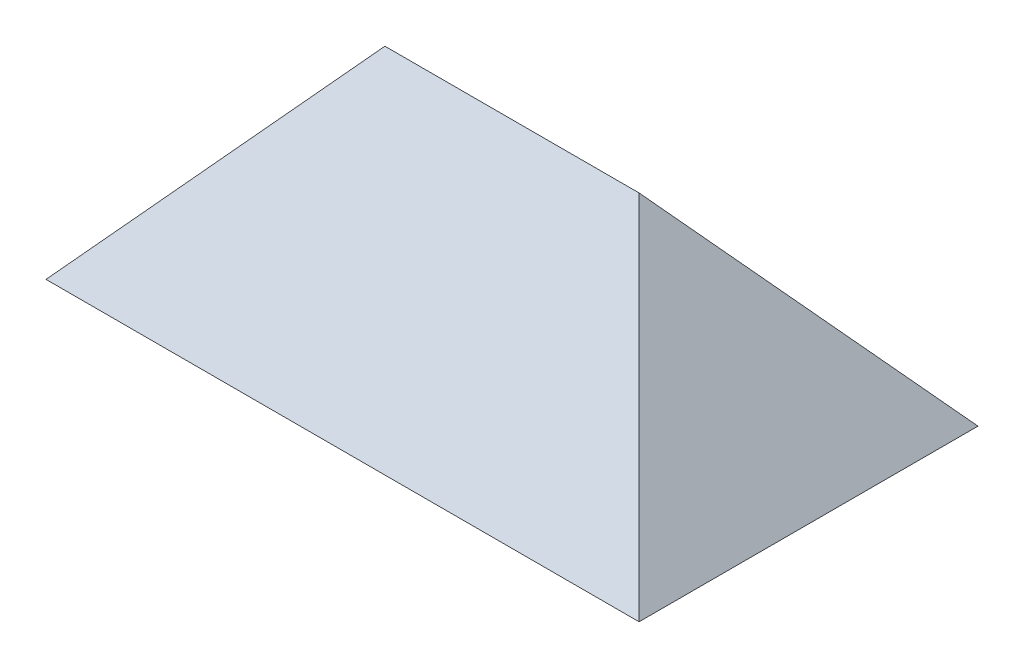
from build123d import *

# Parameters (mm, degrees)
BOSS_EXTRUDE2_DEPTH = 120
CUT_EXTRUDE3_DEPTH  = 150
SHELL3_T            = -4


with BuildPart() as part:
    # Sketch1 → Boss-Extrude2 (new body)
    with BuildSketch(Plane.XY):
        Polygon((0, 125.134127222), (105, 0), (0, 0), (-105, 0), align=None)
    extrude(amount=BOSS_EXTRUDE2_DEPTH)

    # Sketch4 → Cut-Extrude3 (cut, symmetric)
    with BuildSketch(Plane(origin=(0, 0, 0), x_dir=(0, 0, -1), z_dir=(1, 0, 0))):
        Polygon((-120, 0), (-60, 71.505215556), (0, 0), (0, 135.134127222), (-120, 135.134127222), align=None)
    extrude(amount=CUT_EXTRUDE3_DEPTH, both=True, mode=Mode.SUBTRACT)

    # Shell3
    shell3_openings = [part.faces().sort_by_distance(p)[0] for p in [
        (0, 0, 60),
    ]]
    offset(amount=SHELL3_T, openings=shell3_openings, kind=Kind.INTERSECTION)


solid = part.part
